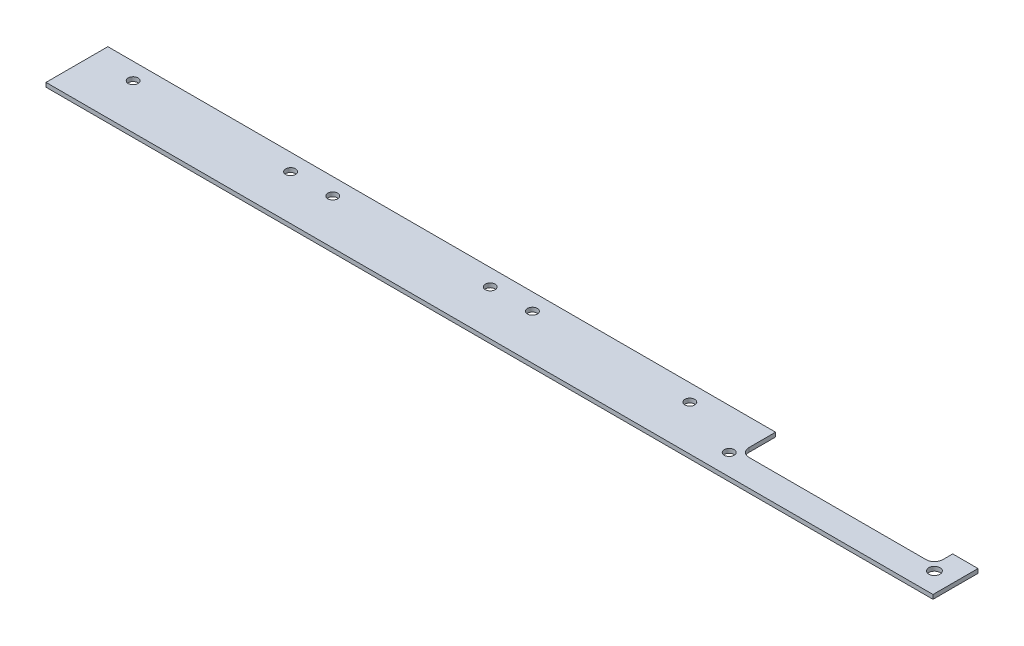
from build123d import *

# Parameters (mm, degrees)
SKETCH_1_R      = 1.75
SKETCH_1_R_2    = 2
EXTRUDE_1_DEPTH = 1.5


with BuildPart() as part:
    # Эскиз1 → Бобышка-Вытянуть1 (new body)
    with BuildSketch(Plane(origin=(0, 0, 0), x_dir=(1, 0, 0), z_dir=(0, 1, 0))):
        with BuildLine():
            Line((237.5, 22), (237.5, 12.5))
            ThreePointArc((237.5, 12.5), (238.378679656, 10.378679656), (240.5, 9.5))
            Line((240.5, 9.5), (303.5, 9.5))
            ThreePointArc((303.5, 9.5), (305.621320344, 10.378679656), (306.5, 12.5))
            Line((306.5, 12.5), (306.5, 16))
            Line((306.5, 16), (315.5, 16))
            Line((315.5, 16), (315.5, 0))
            Line((315.5, 0), (0, 0))
            Line((0, 0), (0, 22))
            Line((0, 22), (237.5, 22))
        make_face()
        with Locations((235.5, 7.5)):
            Circle(SKETCH_1_R, mode=Mode.SUBTRACT)
        with Locations((71, 16)):
            Circle(SKETCH_1_R, mode=Mode.SUBTRACT)
        with Locations((15, 16)):
            Circle(SKETCH_1_R, mode=Mode.SUBTRACT)
        with Locations((86, 16)):
            Circle(SKETCH_1_R, mode=Mode.SUBTRACT)
        with Locations((142, 16)):
            Circle(SKETCH_1_R, mode=Mode.SUBTRACT)
        with Locations((308.5, 7.5)):
            Circle(SKETCH_1_R_2, mode=Mode.SUBTRACT)
        with Locations((157, 16)):
            Circle(SKETCH_1_R, mode=Mode.SUBTRACT)
        with Locations((213, 16)):
            Circle(SKETCH_1_R, mode=Mode.SUBTRACT)
    extrude(amount=EXTRUDE_1_DEPTH)


solid = part.part
